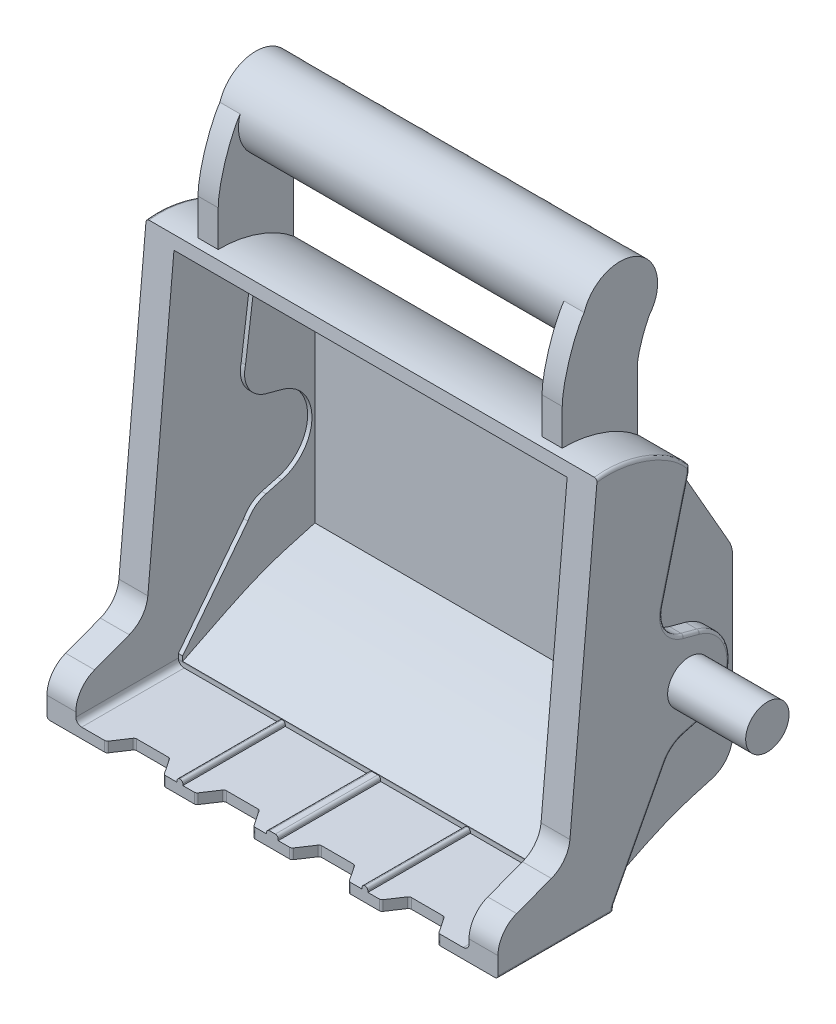
from build123d import *

# Parameters (mm, degrees)
BOSS_EXTRUDE3_DEPTH  = 36.5
BOSS_EXTRUDE4_DEPTH  = 2.5
SKETCH6_R            = 3.7500000000000004
BOSS_EXTRUDE5_DEPTH  = 16
BOSS_EXTRUDE6_START  = 2.5
SKETCH6_3_R          = 3.7500000000000004
BOSS_EXTRUDE6_DEPTH  = 2.5
BOSS_EXTRUDE7_DEPTH  = 0.74
SKETCH10_W           = 1
SKETCH10_H           = 17.717822677061807
CUT_EXTRUDE2_DEPTH   = 0.74
CUT_EXTRUDE3_DEPTH   = 79.09539858298793
SKETCH10_5_W         = 1
SKETCH10_5_H         = 17.717822677061807
BOSS_EXTRUDE8_DEPTH  = 0.74
FILLET1_R            = 5
FILLET2_R            = 0.5
FILLET3_R            = 0.5
FILLET4_R            = 0.5
FILLET5_R            = 1
BOSS_EXTRUDE9_DEPTH  = 3.5
SKETCH11_4_R         = 6.5
BOSS_EXTRUDE10_DEPTH = 31.5
SKETCH13_W           = 6.000000000000057
SKETCH13_H           = 4.5
SKETCH13_W_2         = 6.0000000000000036
SKETCH13_H_2         = 4.500000000000007
SKETCH13_W_3         = 6
CUT_EXTRUDE5_DEPTH   = 10


with BuildPart() as part:
    # Sketch1 → Boss-Extrude3 (new body)
    with BuildSketch(Plane(origin=(0, 0, 0), x_dir=(0, 0, -1), z_dir=(1, 0, 0))):
        with BuildLine():
            add(Edge.make_bspline(
                [(16, -6), (10.327764703310187, 1.4347426216337056), (0, 0)],
                knots=[0, 0, 0, 1, 1, 1], degree=2, weights=[1, 0.669759800624134, 1]))
            Line((0, 0), (-0.19652075968794278, -2.152777061982766))
            Line((-0.1965207596879428, -2.152777061982766), (2.293127228972036, -2.380049789255505))
            add(Edge.make_bspline(
                [(13.499999999999332, -6.919392478614998), (13.372895527222926, -6.786005809421245), (13.120225191504794, -6.536812659082002), (12.503654127224127, -5.99505348599364), (11.577947837150704, -5.308504990162823), (10.226118616886913, -4.506382723260011), (8.689313229623657, -3.7839488710620914), (7.039981207553613, -3.185230887558608), (5.362631673140604, -2.741799419796221), (4.017396552506603, -2.5130149891703804), (3.000072511042216, -2.4115187578721353), (2.532433050098863, -2.386836853356118), (2.293127228972036, -2.380049789255505)],
                knots=[0.07945934370652563, 0.07945934370652563, 0.07945934370652563, 0.07945934370652563, 0.1274534016370964, 0.1754474595676672, 0.27143557542880875, 0.36742369128995034, 0.46341180715109187, 0.5593999230122335, 0.655388038873375, 0.7513761547345166, 0.7993702126650873, 0.8473642705956581, 0.8473642705956581, 0.8473642705956581, 0.8473642705956581], degree=3))
            Line((13.499999999999332, -6.919392478614998), (13.500000000000004, -7.6643400487754825))
            Line((13.500000000000004, -7.6643400487754825), (23.428344460938355, -25.02602131139965))
            Line((23.428344460938355, -25.02602131139965), (23.42834446093838, -54.440100810215355))
            add(Edge.make_bspline(
                [(0.5649159842651759, -63.75174305710289), (1.221937447242853, -63.42141786317467), (2.615735911109803, -62.720242184725464), (4.228713929052562, -61.913248848167754), (5.562808710031312, -61.249737072649005), (7.047122000150568, -60.51685903000842), (8.503822751361302, -59.80724689084491), (9.872969229304761, -59.1546188666341), (11.003296904537653, -58.630459643477764), (11.981646705528517, -58.191832375005056), (12.865151157576197, -57.81131167514523), (13.971883970277526, -57.35633877349705), (15.036733907775158, -56.95170775351978), (16.18154678102017, -56.55282177448846), (17.118209081565126, -56.24485018966025), (18.185026081379508, -55.91292696006839), (19.24667009123651, -55.5988188270062), (20.26665481033881, -55.307365589212594), (21.141624588782424, -55.06233586118324), (21.997172027396754, -54.82710671446813), (22.76936649306293, -54.617427612903136), (23.213466800017088, -54.49778288438559), (23.42834446093838, -54.440100810215355)],
                knots=[-0.01900225381773252, -0.01900225381773252, -0.01900225381773252, -0.01900225381773252, 0.01168569835029338, 0.04237365051831928, 0.07306160268634518, 0.10374955485437107, 0.16512545919042287, 0.22650136352647465, 0.28787726786252643, 0.3492531721985782, 0.41062907653463, 0.4720049808706818, 0.5947567895427854, 0.6561326938788372, 0.717508598214889, 0.7788845025509408, 0.8402604068869926, 0.8709483590550184, 0.9016363112230443, 0.9323242633910702, 0.9476682394750833, 0.9630122155590962, 0.9630122155590962, 0.9630122155590962, 0.9630122155590962], degree=3))
            Line((0.5649159842651759, -63.75174305710289), (0.5548800450826359, -63.86168126262416))
            Line((0.5548800450826352, -63.86168126262416), (-14.66294263197917, -63.86168126262416))
            Line((-14.66294263197917, -63.86168126262416), (-17.16294263197917, -63.86168126262416))
            Line((-17.16294263197917, -63.86168126262416), (-17.16294263197917, -66.36168126262416))
            Line((-17.16294263197917, -66.36168126262416), (2.8370573680208295, -66.36168126262415))
            Line((2.8370573680208295, -66.36168126262415), (2.9283444609383573, -65.36168126262415))
            add(Edge.make_bspline(
                [(2.9283444609383573, -65.36168126262415), (15.180048524285764, -59.20199432890522), (25.92834446093835, -56.36168126262415)],
                knots=[0, 0, 0, 1, 1, 1], degree=2, weights=[1, 2.66410922651943, 1]))
            Line((25.92834446093835, -56.36168126262415), (25.928344460938348, -24.361681262624156))
            Line((25.928344460938348, -24.361681262624156), (16.000000000000004, -7))
            Line((16.000000000000004, -7), (16, -6))
        make_face()
    extrude(amount=-BOSS_EXTRUDE3_DEPTH)

    # Sketch1<8> → Boss-Extrude4 (add)
    with BuildSketch(Plane(origin=(0, 0, 0), x_dir=(0, 0, -1), z_dir=(1, 0, 0))):
        with BuildLine():
            Line((0.5548800450826359, -63.86168126262416), (0.5649159842651759, -63.75174305710289))
            add(Edge.make_bspline(
                [(0.5649159842651759, -63.75174305710289), (1.221937447242853, -63.42141786317467), (2.615735911109803, -62.720242184725464), (4.228713929052562, -61.913248848167754), (5.562808710031312, -61.249737072649005), (7.047122000150568, -60.51685903000842), (8.503822751361302, -59.80724689084491), (9.872969229304761, -59.1546188666341), (11.003296904537653, -58.630459643477764), (11.981646705528517, -58.191832375005056), (12.865151157576197, -57.81131167514523), (13.971883970277526, -57.35633877349705), (15.036733907775158, -56.95170775351978), (16.18154678102017, -56.55282177448846), (17.118209081565126, -56.24485018966025), (18.185026081379508, -55.91292696006839), (19.24667009123651, -55.5988188270062), (20.26665481033881, -55.307365589212594), (21.141624588782424, -55.06233586118324), (21.997172027396754, -54.82710671446813), (22.76936649306293, -54.617427612903136), (23.213466800017088, -54.49778288438559), (23.42834446093838, -54.440100810215355)],
                knots=[-0.01900225381773252, -0.01900225381773252, -0.01900225381773252, -0.01900225381773252, 0.01168569835029338, 0.04237365051831928, 0.07306160268634518, 0.10374955485437107, 0.16512545919042287, 0.22650136352647465, 0.28787726786252643, 0.3492531721985782, 0.41062907653463, 0.4720049808706818, 0.5947567895427854, 0.6561326938788372, 0.717508598214889, 0.7788845025509408, 0.8402604068869926, 0.8709483590550184, 0.9016363112230443, 0.9323242633910702, 0.9476682394750833, 0.9630122155590962, 0.9630122155590962, 0.9630122155590962, 0.9630122155590962], degree=3))
            Line((23.42834446093838, -54.440100810215355), (23.428344460938355, -25.02602131139965))
            Line((23.428344460938355, -25.02602131139965), (13.500000000000004, -7.6643400487754825))
            Line((13.500000000000004, -7.6643400487754825), (13.499999999999332, -6.919392478614998))
            add(Edge.make_bspline(
                [(13.499999999999332, -6.919392478614998), (13.372895527222926, -6.786005809421245), (13.120225191504794, -6.536812659082002), (12.503654127224127, -5.99505348599364), (11.577947837150704, -5.308504990162823), (10.226118616886913, -4.506382723260011), (8.689313229623657, -3.7839488710620914), (7.039981207553613, -3.185230887558608), (5.362631673140604, -2.741799419796221), (4.017396552506603, -2.5130149891703804), (3.000072511042216, -2.4115187578721353), (2.532433050098863, -2.386836853356118), (2.293127228972036, -2.380049789255505)],
                knots=[0.07945934370652563, 0.07945934370652563, 0.07945934370652563, 0.07945934370652563, 0.1274534016370964, 0.1754474595676672, 0.27143557542880875, 0.36742369128995034, 0.46341180715109187, 0.5593999230122335, 0.655388038873375, 0.7513761547345166, 0.7993702126650873, 0.8473642705956581, 0.8473642705956581, 0.8473642705956581, 0.8473642705956581], degree=3))
            Line((2.293127228972036, -2.380049789255505), (-2.225706968529056, -51.88139826119616))
            ThreePointArc((-2.225706968529056, -51.88139826119616), (-3.726339263811534, -55.741524134672076), (-7.046905446754281, -58.216662367058305))
            Line((-7.046905446754281, -58.216662367058305), (-13.045524461230595, -60.48011258428351))
            ThreePointArc((-13.045524461230595, -60.48011258428351), (-14.219208005554357, -61.39724947150795), (-14.66294263197917, -62.8191400135103))
            Line((-14.66294263197917, -62.8191400135103), (-14.66294263197917, -63.86168126262416))
            Line((-14.66294263197917, -63.86168126262416), (0.5548800450826359, -63.86168126262416))
        make_face()
        with BuildLine():
            Line((2.293127228972036, -2.380049789255505), (-0.1965207596879428, -2.152777061982766))
            Line((-0.19652075968794278, -2.152777061982766), (-4.715354957188901, -51.65412553392342))
            ThreePointArc((-4.715354957188903, -51.65412553392342), (-5.715776487377217, -54.22754278290737), (-7.929487276005716, -55.87763493783153))
            Line((-7.929487276005717, -55.87763493783153), (-13.928106290482047, -58.14108515505675))
            ThreePointArc((-13.928106290482047, -58.14108515505675), (-16.275473379129547, -59.975358929505624), (-17.16294263197917, -62.819140013510314))
            Line((-17.16294263197917, -62.819140013510314), (-17.16294263197917, -63.86168126262416))
            Line((-17.16294263197917, -63.86168126262416), (-14.66294263197917, -63.86168126262416))
            Line((-14.66294263197917, -63.86168126262416), (-14.66294263197917, -62.8191400135103))
            ThreePointArc((-14.662942631979172, -62.8191400135103), (-14.219208005554355, -61.39724947150795), (-13.045524461230595, -60.48011258428351))
            Line((-13.045524461230595, -60.48011258428351), (-7.046905446754281, -58.216662367058305))
            ThreePointArc((-7.046905446754281, -58.216662367058305), (-3.726339263811534, -55.741524134672076), (-2.2257069685290576, -51.88139826119616))
            Line((-2.225706968529056, -51.88139826119617), (2.293127228972036, -2.380049789255505))
        make_face()
    extrude(amount=-BOSS_EXTRUDE4_DEPTH)

    # Sketch6 → Boss-Extrude5 (add)
    with BuildSketch(Plane(origin=(0, 0, 0), x_dir=(0, 0, -1), z_dir=(1, 0, 0))):
        with Locations((15.928344460938353, -38.36168126262415)):
            Circle(SKETCH6_R)
    extrude(amount=BOSS_EXTRUDE5_DEPTH)

    # Sketch6<3> → Boss-Extrude6 (add)
    with BuildSketch(Plane(origin=(0, 0, 0), x_dir=(0, 0, -1), z_dir=(1, 0, 0)).offset(BOSS_EXTRUDE6_START)):
        with BuildLine():
            Line((16.000000000000007, -6.999999999999999), (11.433308730468866, -24.788285887235517))
            ThreePointArc((11.433308730468866, -24.788285887235517), (11.95932132309253, -28.55429355300545), (14.982166313396183, -30.86122032922369))
            Line((14.982166313396183, -30.86122032922369), (17.74007777665598, -31.60020047860067))
            ThreePointArc((17.74007777665598, -31.60020047860067), (22.928344460938355, -38.36168126262415), (17.74007777665598, -45.12316204664762))
            Line((17.74007777665598, -45.12316204664762), (14.982166313396203, -45.86214219602461))
            ThreePointArc((14.982166313396203, -45.86214219602461), (13.153349915792626, -46.786976455238374), (11.849168658138167, -48.36779873188494))
            Line((11.849168658138167, -48.36779873188494), (2.928344460938358, -65.36168126262415))
            Line((2.928344460938358, -65.36168126262415), (2.8370573680208295, -66.36168126262415))
            Line((2.8370573680208295, -66.36168126262415), (-17.16294263197917, -66.36168126262416))
            Line((-17.16294263197917, -66.36168126262416), (-17.16294263197917, -62.819140013510314))
            ThreePointArc((-17.16294263197917, -62.819140013510314), (-16.275473379129558, -59.97535892950561), (-13.928106290482043, -58.141085155056736))
            Line((-13.928106290482043, -58.141085155056736), (-7.929487276005717, -55.877634937831516))
            ThreePointArc((-7.929487276005717, -55.877634937831516), (-5.715776487377223, -54.22754278290736), (-4.7153549571889, -51.65412553392342))
            Line((-4.7153549571889, -51.65412553392342), (0, 0))
            add(Edge.make_bspline(
                [(16, -6), (10.327764703310187, 1.4347426216337056), (0, 0)],
                knots=[0, 0, 0, 1, 1, 1], degree=2, weights=[1, 0.669759800624134, 1]))
            Line((16, -6), (16.000000000000007, -6.999999999999999))
        make_face()
        with Locations((15.928344460938353, -38.36168126262415)):
            Circle(SKETCH6_3_R, mode=Mode.SUBTRACT)
    extrude(amount=-BOSS_EXTRUDE6_DEPTH)

    # Sketch9 → Boss-Extrude7 (add)
    with BuildSketch(Plane.ZY.offset(2.5)):
        with BuildLine():
            add(Edge.make_bspline(
                [(-15.693278275622319, -55.940471680841334), (-15.44319876334214, -56.02650243813626), (-14.633912925825125, -56.311975598133145), (-13.604107976957449, -56.70604951737023), (-12.489941912504856, -57.16648991559301), (-11.67547446860274, -57.51873475040094), (-11.109466342571059, -57.77213565202815), (-10.85525280880246, -57.88750877936884)],
                knots=[0.3059127649451535, 0.3059127649451535, 0.3059127649451535, 0.3059127649451535, 0.35771845411585856, 0.47896971457186743, 0.5395953447998718, 0.6002209750278763, 0.6453419375852524, 0.6453419375852524, 0.6453419375852524, 0.6453419375852524], degree=3))
            add(Edge.make_bspline(
                [(-22.688344460939042, -53.87299583010099), (-22.4911596788713, -53.92625129196914), (-22.08331907034144, -54.036828193456174), (-21.376641118853648, -54.23001783542982), (-20.577650877188013, -54.451233050656896), (-19.758150345739807, -54.682525887021356), (-18.79023158190969, -54.96133152876613), (-17.77149411079384, -55.26538521111351), (-16.732481692559023, -55.591541414959984), (-16.072869700307113, -55.8103699306339), (-15.735854421085445, -55.92582490708728), (-15.693278275622319, -55.940471680841334)],
                knots=[-0.00603532725216815, -0.00603532725216815, -0.00603532725216815, -0.00603532725216815, 0.00912108030483296, 0.02427748786183407, 0.05459030297583629, 0.08490311808983853, 0.11521593320384074, 0.1758415634318452, 0.23646719365984964, 0.2970928238878541, 0.3059127649451535, 0.3059127649451535, 0.3059127649451535, 0.3059127649451535], degree=3))
            Line((-22.688344460939042, -53.87299583010099), (-22.688344460939007, -52.359535858720456))
            add(Edge.make_bspline(
                [(-22.688344460956486, -52.359535858726304), (-22.932748148615545, -52.23444578731796), (-23.179408755444335, -52.108202859103685), (-23.428344460950047, -51.98079778521592)],
                knots=[1.1561517904198297, 1.1561517904198297, 1.1561517904198297, 1.1561517904198297, 1.1577900224394246, 1.1577900224394246, 1.1577900224394246, 1.1577900224394246], degree=3))
            Line((-23.428344460938376, -51.98079778521199), (-23.42834446093838, -54.440100810215355))
            add(Edge.make_bspline(
                [(-23.428344460938757, -54.44010081021526), (-23.21346680001735, -54.49778288438553), (-22.769366493063043, -54.61742761290311), (-21.997172027396754, -54.82710671446813), (-21.141624588782424, -55.06233586118324), (-20.26665481033881, -55.307365589212594), (-19.609582393243084, -55.49511926810689), (-19.242867125501764, -55.60168750341761), (-19.112917400802054, -55.639697953926145)],
                knots=[-0.01900225381774136, -0.01900225381774136, -0.01900225381774136, -0.01900225381774136, -0.00365827773371958, 0.01168569835029348, 0.04237365051831937, 0.07306160268634526, 0.10374955485437115, 0.12145015638797421, 0.12145015638797421, 0.12145015638797421, 0.12145015638797421], degree=3))
            add(Edge.make_bspline(
                [(-19.112917400802054, -55.639697953926145), (-18.792273293618457, -55.733486740282714), (-18.082470619659567, -55.94483546928065), (-17.118209081565126, -56.24485018966025), (-16.18154678102017, -56.55282177448846), (-15.036733907775158, -56.95170775351978), (-13.971883970277526, -57.35633877349705), (-12.865151157576197, -57.81131167514523), (-11.981646705528517, -58.191832375005056), (-11.003296904537653, -58.630459643477764), (-9.872969229304761, -59.1546188666341), (-8.503822751361302, -59.80724689084491), (-7.047122000150568, -60.51685903000842), (-5.757566146168708, -61.15357580431285), (-5.130065075159611, -61.46514607073388), (-4.918594623022003, -61.57031886005116)],
                knots=[0.12145015638797421, 0.12145015638797421, 0.12145015638797421, 0.12145015638797421, 0.16512545919042293, 0.2265013635264747, 0.2878772678625265, 0.34925317219857827, 0.4720049808706819, 0.5333808852067337, 0.5947567895427854, 0.6561326938788372, 0.717508598214889, 0.7788845025509408, 0.8402604068869926, 0.8709483590550184, 0.8855299893991077, 0.8855299893991077, 0.8855299893991077, 0.8855299893991077], degree=3))
            Line((-4.918594623021709, -61.57031886005089), (-4.996689754402145, -61.42155015218661))
            Line((-4.996689754402145, -61.42155015218661), (-5.5049286700691615, -60.45337140104536))
            add(Edge.make_bspline(
                [(-10.85525280880246, -57.88750877936884), (-10.767898813340901, -57.927153811215476), (-10.331611878596156, -58.12602018690309), (-9.476065656007579, -58.52362242086986), (-8.099579447840929, -59.18070488504825), (-6.734099824086753, -59.84647316204339), (-5.763554977093181, -60.325410491203996), (-5.504928670068848, -60.45337140104506)],
                knots=[0.6453419375852524, 0.6453419375852524, 0.6453419375852524, 0.6453419375852524, 0.6608466052558808, 0.7214722354838852, 0.7820978657118897, 0.8427234959398942, 0.8630626291427256, 0.8630626291427256, 0.8630626291427256, 0.8630626291427256], degree=3))
        make_face()
        with BuildLine():
            add(Edge.make_bspline(
                [(-22.688344460939042, -53.87299583010099), (-22.4911596788713, -53.92625129196914), (-22.08331907034144, -54.036828193456174), (-21.376641118853648, -54.23001783542982), (-20.577650877188013, -54.451233050656896), (-19.758150345739807, -54.682525887021356), (-18.79023158190969, -54.96133152876613), (-17.77149411079384, -55.26538521111351), (-16.732481692559023, -55.591541414959984), (-16.072869700307113, -55.8103699306339), (-15.735854421085445, -55.92582490708728), (-15.693278275622319, -55.940471680841334)],
                knots=[-0.00603532725216815, -0.00603532725216815, -0.00603532725216815, -0.00603532725216815, 0.00912108030483296, 0.02427748786183407, 0.05459030297583629, 0.08490311808983853, 0.11521593320384074, 0.1758415634318452, 0.23646719365984964, 0.2970928238878541, 0.3059127649451535, 0.3059127649451535, 0.3059127649451535, 0.3059127649451535], degree=3))
            add(Edge.make_bspline(
                [(-15.693278275623399, -55.940471680844006), (-17.78858578027233, -54.8675702689192), (-20.113186089111906, -53.67754684173244), (-22.688344460956433, -52.35953585872632)],
                knots=[1.1388905660058648, 1.1388905660058648, 1.1388905660058648, 1.1388905660058648, 1.1561517904198297, 1.1561517904198297, 1.1561517904198297, 1.1561517904198297], degree=3))
            Line((-22.688344460939007, -52.359535858720456), (-22.688344460939042, -53.87299583010099))
        make_face()
        with BuildLine():
            add(Edge.make_bspline(
                [(-15.693278275623399, -55.940471680844006), (-17.78858578027233, -54.8675702689192), (-20.113186089111906, -53.67754684173244), (-22.688344460956433, -52.35953585872632)],
                knots=[1.1388905660058648, 1.1388905660058648, 1.1388905660058648, 1.1388905660058648, 1.1561517904198297, 1.1561517904198297, 1.1561517904198297, 1.1561517904198297], degree=3))
            add(Edge.make_bspline(
                [(-15.693278275622319, -55.940471680841334), (-15.44319876334214, -56.02650243813626), (-14.633912925825125, -56.311975598133145), (-13.604107976957449, -56.70604951737023), (-12.489941912504856, -57.16648991559301), (-11.67547446860274, -57.51873475040094), (-11.109466342571059, -57.77213565202815), (-10.85525280880246, -57.88750877936884)],
                knots=[0.3059127649451535, 0.3059127649451535, 0.3059127649451535, 0.3059127649451535, 0.35771845411585856, 0.47896971457186743, 0.5395953447998718, 0.6002209750278763, 0.6453419375852524, 0.6453419375852524, 0.6453419375852524, 0.6453419375852524], degree=3))
            add(Edge.make_bspline(
                [(-10.85525280880246, -57.88750877936884), (-10.767898813340901, -57.927153811215476), (-10.331611878596156, -58.12602018690309), (-9.476065656007579, -58.52362242086986), (-8.099579447840929, -59.18070488504825), (-6.734099824086753, -59.84647316204339), (-5.763554977093181, -60.325410491203996), (-5.504928670068848, -60.45337140104506)],
                knots=[0.6453419375852524, 0.6453419375852524, 0.6453419375852524, 0.6453419375852524, 0.6608466052558808, 0.7214722354838852, 0.7820978657118897, 0.8427234959398942, 0.8630626291427256, 0.8630626291427256, 0.8630626291427256, 0.8630626291427256], degree=3))
            Line((-5.5049286700691615, -60.45337140104536), (-6.185800121251382, -59.1563332345992))
            Line((-6.185800121251382, -59.1563332345992), (-11.849168658138165, -48.36779873188494))
            ThreePointArc((-11.849168658138165, -48.36779873188494), (-13.153349915792626, -46.786976455238374), (-14.982166313396203, -45.86214219602461))
            Line((-14.982166313396203, -45.86214219602461), (-17.74007777665598, -45.12316204664763))
            ThreePointArc((-17.740077776655983, -45.12316204664763), (-20.876071804116567, -43.31344803192646), (-22.688344460938744, -40.17893193327881))
            Line((-22.688344460938712, -40.178931933278804), (-22.688344460939007, -52.359535858720456))
        make_face()
        with BuildLine():
            add(Edge.make_bspline(
                [(-4.918594623022003, -61.57031886005116), (-4.685012295256962, -61.686488777398694), (-3.973240716177309, -62.0410653330584), (-2.615735911109804, -62.720242184725464), (-1.2219374472428524, -63.42141786317467), (-0.5649159842651743, -63.75174305710289)],
                knots=[0.8855299893991077, 0.8855299893991077, 0.8855299893991077, 0.8855299893991077, 0.9016363112230443, 0.9323242633910702, 0.9630122155590962, 0.9630122155590962, 0.9630122155590962, 0.9630122155590962], degree=3))
            Line((-0.5649159842651759, -63.75174305710289), (-0.564915984265176, -63.69813101385873))
            Line((-0.564915984265176, -63.69813101385873), (-0.5649159842651768, -62.92346860770819))
            add(Edge.make_bspline(
                [(-5.504928670068848, -60.45337140104506), (-5.378106327425337, -60.51611947389023), (-4.851444627127389, -60.777004210244584), (-3.81705633594621, -61.29164575579783), (-2.332491123769895, -62.03466508284736), (-1.1254019714349306, -62.641638132897874), (-0.5980334504337828, -62.906816227265566), (-0.5649159842651768, -62.92346860770819)],
                knots=[0.8630626291427256, 0.8630626291427256, 0.8630626291427256, 0.8630626291427256, 0.8730363110538963, 0.9033491261678985, 0.9336619412819007, 0.9563561698567021, 0.9578798871645423, 0.9578798871645423, 0.9578798871645423, 0.9578798871645423], degree=3))
            Line((-5.5049286700691615, -60.45337140104536), (-4.996689754402145, -61.42155015218661))
            Line((-4.996689754402145, -61.42155015218661), (-4.918594623021709, -61.57031886005089))
        make_face()
        with BuildLine():
            add(Edge.make_bspline(
                [(-5.504928670068848, -60.45337140104506), (-5.378106327425337, -60.51611947389023), (-4.851444627127389, -60.777004210244584), (-3.81705633594621, -61.29164575579783), (-2.332491123769895, -62.03466508284736), (-1.1254019714349306, -62.641638132897874), (-0.5980334504337828, -62.906816227265566), (-0.5649159842651768, -62.92346860770819)],
                knots=[0.8630626291427256, 0.8630626291427256, 0.8630626291427256, 0.8630626291427256, 0.8730363110538963, 0.9033491261678985, 0.9336619412819007, 0.9563561698567021, 0.9578798871645423, 0.9578798871645423, 0.9578798871645423, 0.9578798871645423], degree=3))
            Line((-0.5649159842651787, -62.92346860770819), (-2.7652688349231127, -60.08521155780548))
            add(Edge.make_bspline(
                [(-2.7652688349288503, -60.08521155781328), (-3.9672579266193146, -59.75886985401469), (-5.106434453299451, -59.44951342913208), (-6.185800121246439, -59.15633323459358)],
                knots=[-0.18004778915487693, -0.18004778915487693, -0.18004778915487693, -0.18004778915487693, -0.17210903128132413, -0.17210903128132413, -0.17210903128132413, -0.17210903128132413], degree=3))
            Line((-6.185800121251382, -59.1563332345992), (-5.5049286700691615, -60.45337140104536))
        make_face()
        with BuildLine():
            add(Edge.make_bspline(
                [(-2.7652688349288503, -60.08521155781328), (-3.9672579266193146, -59.75886985401469), (-5.106434453299451, -59.44951342913208), (-6.185800121246439, -59.15633323459358)],
                knots=[-0.18004778915487693, -0.18004778915487693, -0.18004778915487693, -0.18004778915487693, -0.17210903128132413, -0.17210903128132413, -0.17210903128132413, -0.17210903128132413], degree=3))
            Line((-2.7652688349231127, -60.08521155780548), (-11.849168658138165, -48.36779873188494))
            Line((-11.849168658138165, -48.36779873188494), (-6.185800121251382, -59.1563332345992))
        make_face()
        with BuildLine():
            add(Edge.make_bspline(
                [(-22.688344460956486, -52.359535858726304), (-22.932748148615545, -52.23444578731796), (-23.179408755444335, -52.108202859103685), (-23.428344460950047, -51.98079778521592)],
                knots=[1.1561517904198297, 1.1561517904198297, 1.1561517904198297, 1.1561517904198297, 1.1577900224394246, 1.1577900224394246, 1.1577900224394246, 1.1577900224394246], degree=3))
            Line((-22.688344460939007, -52.359535858720456), (-22.688344460938712, -40.178931933278804))
            ThreePointArc((-22.688344460938744, -40.17893193327881), (-22.92834446093836, -38.361681262624096), (-22.688344460938712, -36.54443059196939))
            Line((-22.688344460938627, -36.544430591969395), (-22.688344460938353, -25.222665965837187))
            Line((-22.688344460938353, -25.222665965837187), (-14.843575940394041, -11.504530866011528))
            Line((-14.843575940394041, -11.504530866011528), (-15.107697484871947, -10.475718260811366))
            Line((-15.107697484871947, -10.475718260811366), (-23.428344460938355, -25.02602131139965))
            Line((-23.428344460938355, -25.02602131139965), (-23.428344460938376, -51.98079778521199))
        make_face()
        with BuildLine():
            Line((-22.688344460938353, -25.222665965837187), (-22.688344460938627, -36.544430591969395))
            ThreePointArc((-22.688344460938712, -36.54443059196939), (-20.876071804116524, -33.40991449332179), (-17.74007777665598, -31.600200478600676))
            Line((-17.74007777665598, -31.60020047860067), (-14.982166313396183, -30.86122032922369))
            ThreePointArc((-14.982166313396183, -30.86122032922369), (-11.959321323092528, -28.55429355300545), (-11.433308730468859, -24.788285887235517))
            Line((-11.433308730468863, -24.788285887235517), (-14.843575940394041, -11.504530866011528))
            Line((-14.843575940394041, -11.504530866011528), (-22.688344460938353, -25.222665965837187))
        make_face()
        Polygon((-13.500000000000004, -7.6643400487754825), (-15.107697484871947, -10.475718260811366), (-14.843575940394041, -11.504530866011528), (-13.500000000000004, -9.155021607843914), align=None)
        Polygon((-13.500000000000004, -9.155021607843914), (-14.843575940394041, -11.504530866011528), (-11.433308730468863, -24.788285887235517), align=None)
    extrude(amount=BOSS_EXTRUDE7_DEPTH)

    # Sketch10 → Cut-Extrude2 (cut)
    with BuildSketch(Plane(origin=(0, -63.86168126262416, 0), x_dir=(1, 0, 0), z_dir=(0, 1, 0))):
        with Locations((-36, -8.304031293448267)):
            Rectangle(SKETCH10_W, SKETCH10_H)
        Polygon((-20.999999999999996, 0.5548800450826359), (-35.5, 0.5548800450826359), (-35.5, -17.16294263197917), (-33.24999999999999, -17.16294263197917), (-31.249999999999993, -14.162942631979172), (-25.249999999999993, -14.16294263197917), (-23.249999999999993, -17.162942631979167), (-20.999999999999993, -17.16294263197917), align=None)
        Polygon((-19.999999999999996, 0.5548800450826359), (-20.999999999999996, 0.5548800450826359), (-20.999999999999993, -17.16294263197917), (-19.999999999999993, -17.16294263197917), align=None)
        Polygon((-31.249999999999993, -14.162942631979172), (-33.24999999999999, -17.16294263197917), (-23.249999999999993, -17.162942631979167), (-25.249999999999993, -14.16294263197917), align=None)
        Polygon((-2.5, 0.5548800450826359), (-19.999999999999996, 0.5548800450826359), (-19.999999999999993, -17.16294263197917), (-17.749999999999996, -17.16294263197917), (-15.749999999999993, -14.162942631979172), (-9.749999999999996, -14.162942631979172), (-7.749999999999995, -17.16294263197917), (-2.5, -17.16294263197917), align=None)
        Polygon((-15.749999999999993, -14.162942631979172), (-17.749999999999996, -17.16294263197917), (-7.749999999999993, -17.16294263197917), (-9.749999999999996, -14.162942631979172), align=None)
    extrude(amount=-CUT_EXTRUDE2_DEPTH, mode=Mode.SUBTRACT)

    # Sketch10<4> → Cut-Extrude3 (cut, through all)
    with BuildSketch(Plane(origin=(0, -63.86168126262416, 0), x_dir=(1, 0, 0), z_dir=(0, 1, 0))):
        Polygon((-31.249999999999993, -14.162942631979172), (-33.24999999999999, -17.16294263197917), (-23.249999999999993, -17.162942631979167), (-25.249999999999993, -14.16294263197917), align=None)
        Polygon((-15.749999999999993, -14.162942631979172), (-17.749999999999996, -17.16294263197917), (-7.749999999999993, -17.16294263197917), (-9.749999999999996, -14.162942631979172), align=None)
    extrude(amount=-CUT_EXTRUDE3_DEPTH, mode=Mode.SUBTRACT)

    # Sketch10<5> → Boss-Extrude8 (add)
    with BuildSketch(Plane(origin=(0, -63.86168126262416, 0), x_dir=(1, 0, 0), z_dir=(0, 1, 0))):
        with Locations((-36, -8.304031293448267)):
            Rectangle(SKETCH10_5_W, SKETCH10_5_H)
        Polygon((-19.999999999999996, 0.5548800450826359), (-20.999999999999996, 0.5548800450826359), (-20.999999999999993, -17.16294263197917), (-19.999999999999993, -17.16294263197917), align=None)
    extrude(amount=-BOSS_EXTRUDE8_DEPTH)

    # Fillet1
    fillet1_edges = [part.edges().sort_by_distance(p)[0] for p in [
        (-18.25, -24.361681262624156, -25.928344460938348),
        (-18.25, -56.36168126262415, -25.92834446093835),
    ]]
    fillet(fillet1_edges, radius=FILLET1_R)

    # Fillet2
    fillet2_edges = [part.edges().sort_by_distance(p)[0] for p in [
        (2.5, -28.55429355300545, -11.959321323092531),
        (2.5, -15.894142943617759, -13.716654365234437),
        (2.5, -56.864739997254546, -7.388756559538263),
        (2.5, -46.786976455238374, -13.153349915792628),
        (2.5, -45.492652121336114, -16.361122045026093),
        (2.5, -38.361681262624145, -22.928344460938355),
        (2.5, -6.5, -16.000000000000004),
        (2.5, -1.139883253776619, -8.713340927595741),
        (2.5, -66.36168126262416, 7.1629426319791705),
        (2.5, -65.86168126262415, -2.882700914479594),
        (2.5, -31.23071040391218, -16.361122045026082),
        (-17, -66.36168126262415, -2.8370573680208295),
    ]]
    fillet(fillet2_edges, radius=FILLET2_R)

    # Fillet3
    fillet3_edges = [part.edges().sort_by_distance(p)[0] for p in [
        (-35.5, -63.86168126262416, 8.304031293448267),
        (-19.999999999999993, -63.86168126262416, 8.304031293448267),
        (-20.999999999999993, -63.86168126262416, 8.304031293448269),
    ]]
    fillet(fillet3_edges, radius=FILLET3_R - 0.0001)  # a hair under: the kernel refuses the full size

    # Fillet4
    fillet4_edges = [part.edges().sort_by_distance(p)[0] for p in [
        (-25.249999999999993, -65.48168126262416, 14.16294263197917),
        (-23.249999999999993, -65.48168126262416, 17.162942631979167),
        (-33.24999999999999, -65.48168126262416, 17.16294263197917),
        (-31.249999999999993, -65.48168126262416, 14.162942631979172),
        (-9.749999999999996, -65.48168126262416, 14.162942631979172),
        (-7.749999999999994, -65.48168126262416, 17.16294263197917),
        (-17.749999999999996, -65.48168126262416, 17.16294263197917),
        (-15.749999999999993, -65.48168126262416, 14.162942631979172),
    ]]
    fillet(fillet4_edges, radius=FILLET4_R)

    # Fillet5
    fillet5_edges = [part.edges().sort_by_distance(p)[0] for p in [
        (-2.500000000000002, -64.60168126262415, 8.304031293448267),
    ]]
    fillet(fillet5_edges, radius=FILLET5_R)

    # Sketch11 → Boss-Extrude9 (add)
    with BuildSketch(Plane(origin=(-5, 0, 0), x_dir=(0, 0, -1), z_dir=(1, 0, 0))):
        with BuildLine():
            Line((1.4533262180420463, 6.375185001354722), (1.453326218042048, -0.5112856644489574))
            add(Edge.make_bspline(
                [(1.453326218042048, -0.5112856644489574), (8.410730820096914, -2.447992896225367), (14.453326218042049, -6.403160977994026)],
                knots=[0, 0, 0, 1, 1, 1], degree=2, weights=[1, 2.9999999999999982, 1]))
            Line((14.453326218042049, -6.403160977994026), (14.453326218042049, 6.375185001354727))
            add(Edge.make_bspline(
                [(14.453326218042049, 6.375185001354727), (14.827833165271384, 9.195833515164606), (16.47839502417989, 12.473893049332913)],
                knots=[0, 0, 0, 0.7299307087382587, 0.7299307087382587, 0.7299307087382587], degree=2, weights=[1, 0.7831275112882434, 0.8828588013588918]))
            ThreePointArc((16.478395024179846, 12.473893049332942), (8.366643881307688, 10.876490068306374), (5.248538592406794, 18.533488324477563))
            add(Edge.make_bspline(
                [(1.4533262180420463, 6.375185001354722), (1.4533262180420463, 13.046674120854794), (5.2485385924067955, 18.533488324477563)],
                knots=[0, 0, 0, 1, 1, 1], degree=2, weights=[1, 0.6057946790693123, 1]))
        make_face()
    extrude(amount=-BOSS_EXTRUDE9_DEPTH)

    # Sketch11<4> → Boss-Extrude10 (add)
    with BuildSketch(Plane(origin=(-5, 0, 0), x_dir=(0, 0, -1), z_dir=(1, 0, 0))):
        with Locations(Location((11.453326218042044, 16.596839022005977, 0), (0, 0, 320.631959829))):
            Circle(SKETCH11_4_R)
    extrude(amount=-BOSS_EXTRUDE10_DEPTH)

    # Sketch13 → Cut-Extrude5 (cut)
    with BuildSketch(Plane(origin=(0, 0, -17.953326218042044), x_dir=(-1, 0, 0), z_dir=(0, 0, -1))):
        Polygon((8.499999999999998, 21.596839022005977), (8.499999999999998, 17.096839022005977), (14.5, 17.096839022005977), (14.499999999999998, 21.596839022005977), align=None)
        Polygon((21.625, 21.59683902200598), (15.625, 21.59683902200598), (15.625, 17.096839022005977), (21.625000000000004, 17.096839022005977), align=None)
        with Locations((11.500000000000028, 13.846839022005977)):
            Rectangle(SKETCH13_W, SKETCH13_H)
        Polygon((15.625000000000055, 16.096839022005977), (15.625000000000059, 11.596839022005977), (21.625000000000057, 11.596839022005975), (21.625000000000057, 16.096839022005977), align=None)
        with Locations((25.75, 19.34683902200598)):
            Rectangle(SKETCH13_W_2, SKETCH13_H_2)
        Polygon((22.750000000000053, 16.096839022005977), (22.750000000000057, 11.596839022005977), (28.75000000000006, 11.596839022005975), (28.750000000000057, 16.096839022005977), align=None)
        with Locations((32.87500000000006, 13.846839022005977)):
            Rectangle(SKETCH13_W_3, SKETCH13_H)
        Polygon((35.87500000000001, 21.596839022005987), (29.875, 21.596839022005984), (29.875000000000004, 17.096839022005977), (35.87500000000001, 17.096839022005977), align=None)
    extrude(amount=-CUT_EXTRUDE5_DEPTH, mode=Mode.SUBTRACT)

    # Mirror2: part across plane


with BuildPart() as part_1:
    add(part.part)
    add(part.part.mirror(Plane.ZY.offset(36.5)))


solid = part_1.part
